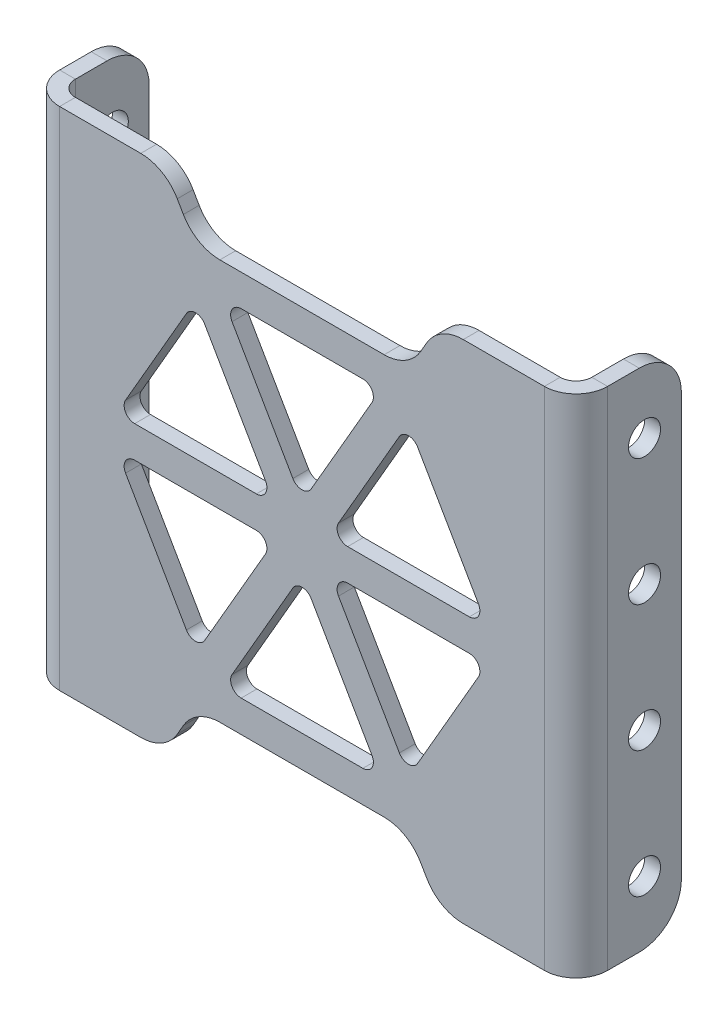
from build123d import *

# Parameters (mm, degrees)
BASE_FLANGE1_DEPTH = 38.1
CUT_EXTRUDE1_DEPTH = 2.38125
FILLET1_R          = 6.35
SKETCH7_R          = 2.413
CUT_EXTRUDE2_DEPTH = 2.38125
FILLET2_R          = 6.35


# Sheet-metal steps are written as plain solids
with BuildPart() as part:
    # Sketch1 → Base-Flange1 (new, symmetric)
    with BuildSketch(Plane(origin=(0, 0, 0), x_dir=(1, 0, 0), z_dir=(0, 1, 0))):
        with BuildLine():
            Line((-41.275, 7.9375), (-41.275, -3.175))
            ThreePointArc((-41.275, -3.175), (-39.880096045, -6.542596045), (-36.5125, -7.9375))
            Line((-36.5125, -7.9375), (36.5125, -7.9375))
            ThreePointArc((36.5125, -7.9375), (39.880096045, -6.542596045), (41.275, -3.175))
            Line((41.275, -3.175), (41.275, 7.9375))
            Line((41.275, 7.9375), (38.89375, 7.9375))
            Line((38.89375, 7.9375), (38.89375, -3.175))
            ThreePointArc((38.89375, -3.175), (38.196298023, -4.858798023), (36.5125, -5.55625))
            Line((36.5125, -5.55625), (-36.5125, -5.55625))
            ThreePointArc((-36.5125, -5.55625), (-38.196298023, -4.858798023), (-38.89375, -3.175))
            Line((-38.89375, -3.175), (-38.89375, 7.9375))
            Line((-38.89375, 7.9375), (-41.275, 7.9375))
        make_face()
    extrude(amount=BASE_FLANGE1_DEPTH, both=True)

    # Sketch6 → Cut-Extrude1 (cut)
    with BuildSketch(Plane.XY.offset(7.9375)):
        with BuildLine():
            Line((-10.540250852, 23.01875), (-1.374815329, 7.14375))
            ThreePointArc((-1.374815329, 7.14375), (0, 6.35), (1.374815329, 7.14375))
            Line((1.374815329, 7.14375), (10.540250852, 23.01875))
            ThreePointArc((10.540250852, 23.01875), (10.540250852, 24.60625), (9.165435523, 25.4))
            Line((9.165435523, 25.4), (-9.165435523, 25.4))
            ThreePointArc((-9.165435523, 25.4), (-10.540250852, 24.60625), (-10.540250852, 23.01875))
        make_face()
        with BuildLine():
            Line((14.664696837, 20.6375), (5.499261314, 4.7625))
            ThreePointArc((5.499261314, 4.7625), (5.499261314, 3.175), (6.874076643, 2.38125))
            Line((6.874076643, 2.38125), (25.204947689, 2.38125))
            ThreePointArc((25.204947689, 2.38125), (26.579763018, 3.175), (26.579763018, 4.7625))
            Line((26.579763018, 4.7625), (17.414327494, 20.6375))
            ThreePointArc((17.414327494, 20.6375), (16.039512166, 21.43125), (14.664696837, 20.6375))
        make_face()
        with BuildLine():
            Line((25.204947689, -2.38125), (6.874076643, -2.38125))
            ThreePointArc((6.874076643, -2.38125), (5.499261314, -3.175), (5.499261314, -4.7625))
            Line((5.499261314, -4.7625), (14.664696837, -20.6375))
            ThreePointArc((14.664696837, -20.6375), (16.039512166, -21.43125), (17.414327494, -20.6375))
            Line((17.414327494, -20.6375), (26.579763018, -4.7625))
            ThreePointArc((26.579763018, -4.7625), (26.579763018, -3.175), (25.204947689, -2.38125))
        make_face()
        with BuildLine():
            Line((10.540250852, -23.01875), (1.374815329, -7.14375))
            ThreePointArc((1.374815329, -7.14375), (0, -6.35), (-1.374815329, -7.14375))
            Line((-1.374815329, -7.14375), (-10.540250852, -23.01875))
            ThreePointArc((-10.540250852, -23.01875), (-10.540250852, -24.60625), (-9.165435523, -25.4))
            Line((-9.165435523, -25.4), (9.165435523, -25.4))
            ThreePointArc((9.165435523, -25.4), (10.540250852, -24.60625), (10.540250852, -23.01875))
        make_face()
        with BuildLine():
            Line((-14.664696837, -20.6375), (-5.499261314, -4.7625))
            ThreePointArc((-5.499261314, -4.7625), (-5.499261314, -3.175), (-6.874076643, -2.38125))
            Line((-6.874076643, -2.38125), (-25.204947689, -2.38125))
            ThreePointArc((-25.204947689, -2.38125), (-26.579763018, -3.175), (-26.579763018, -4.7625))
            Line((-26.579763018, -4.7625), (-17.414327494, -20.6375))
            ThreePointArc((-17.414327494, -20.6375), (-16.039512166, -21.43125), (-14.664696837, -20.6375))
        make_face()
        with BuildLine():
            Line((-25.204947689, 2.38125), (-6.874076643, 2.38125))
            ThreePointArc((-6.874076643, 2.38125), (-5.499261314, 3.175), (-5.499261314, 4.7625))
            Line((-5.499261314, 4.7625), (-14.664696837, 20.6375))
            ThreePointArc((-14.664696837, 20.6375), (-16.039512166, 21.43125), (-17.414327494, 20.6375))
            Line((-17.414327494, 20.6375), (-26.579763018, 4.7625))
            ThreePointArc((-26.579763018, 4.7625), (-26.579763018, 3.175), (-25.204947689, 2.38125))
        make_face()
        with BuildLine():
            Line((-20.622229928, 38.1), (-17.872599271, 33.3375))
            ThreePointArc((-17.872599271, 33.3375), (-15.548337957, 31.013238686), (-12.373337957, 30.1625))
            Line((-12.373337957, 30.1625), (12.373337957, 30.1625))
            ThreePointArc((12.373337957, 30.1625), (15.548337957, 31.013238686), (17.872599271, 33.3375))
            Line((17.872599271, 33.3375), (20.622229928, 38.1))
            Line((20.622229928, 38.1), (-20.622229928, 38.1))
        make_face()
        with BuildLine():
            Line((-20.622229928, -38.1), (20.622229928, -38.1))
            Line((20.622229928, -38.1), (17.872599271, -33.3375))
            ThreePointArc((17.872599271, -33.3375), (15.548337957, -31.013238686), (12.373337957, -30.1625))
            Line((12.373337957, -30.1625), (-12.373337957, -30.1625))
            ThreePointArc((-12.373337957, -30.1625), (-15.548337957, -31.013238686), (-17.872599271, -33.3375))
            Line((-17.872599271, -33.3375), (-20.622229928, -38.1))
        make_face()
    extrude(amount=-CUT_EXTRUDE1_DEPTH, mode=Mode.SUBTRACT)

    # Fillet1
    fillet1_edges = [part.edges().sort_by_distance(p)[0] for p in [
        (20.622229928, -38.1, 6.746875),
        (-20.622229928, -38.1, 6.746875),
        (-20.622229928, 38.1, 6.746875),
        (20.622229928, 38.1, 6.746875),
    ]]
    fillet(fillet1_edges, radius=FILLET1_R)

    # Sketch7 → Cut-Extrude2 (cut)
    with BuildSketch(Plane(origin=(41.275, 0, 0), x_dir=(0, 0, -1), z_dir=(1, 0, 0))):
        with Locations((2.38125, 28.575)):
            Circle(SKETCH7_R)
        with Locations((2.38125, 9.525)):
            Circle(SKETCH7_R)
        with Locations((2.38125, -9.525)):
            Circle(SKETCH7_R)
        with Locations((2.38125, -28.575)):
            Circle(SKETCH7_R)
    cut_extrude2 = extrude(amount=-CUT_EXTRUDE2_DEPTH, mode=Mode.SUBTRACT)

    # Mirror1: Cut-Extrude2 across plane
    add(cut_extrude2.mirror(Plane(origin=(0, 0, 0), x_dir=(0, 0, 1), z_dir=(1, 0, 0))), mode=Mode.SUBTRACT)

    # Fillet2
    fillet2_edges = [part.edges().sort_by_distance(p)[0] for p in [
        (40.084375, 38.1, -7.9375),
        (-40.084375, 38.1, -7.9375),
        (40.084375, -38.1, -7.9375),
        (-40.084375, -38.1, -7.9375),
    ]]
    fillet(fillet2_edges, radius=FILLET2_R)


solid = part.part
